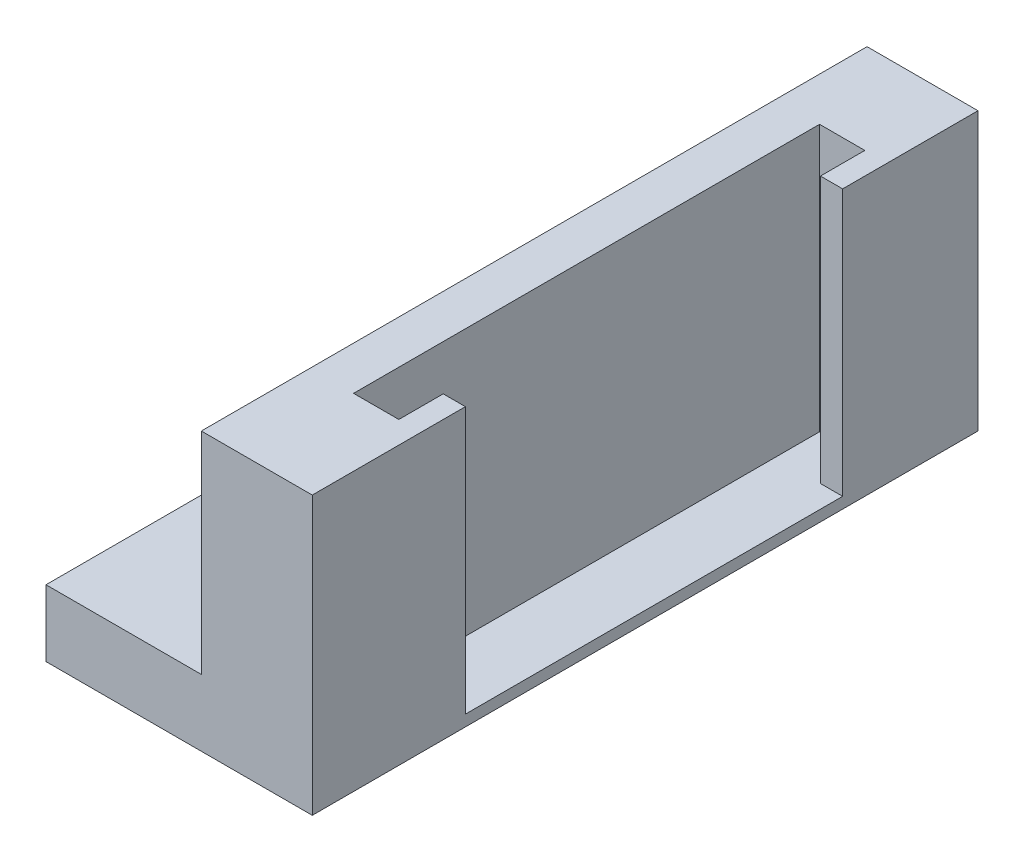
from build123d import *

# Parameters (mm, degrees)
SALIENTE_EXTRUIR1_DEPTH = 30
CORTAR_EXTRUIR1_DEPTH   = 12
CORTAR_EXTRUIR2_REACH   = 35.679
CROQUIS3_R              = 1.65


with BuildPart() as part:
    # Croquis1 → Saliente-Extruir1 (new body)
    with BuildSketch(Plane.XY):
        Polygon((12, 0), (12, 12.5), (7, 12.5), (7, 3), (0, 3), (0, 0), align=None)
    extrude(amount=SALIENTE_EXTRUIR1_DEPTH)

    # Croquis2 → Cortar-Extruir1 (cut)
    with BuildSketch(Plane(origin=(0, 12.5, 0), x_dir=(1, 0, 0), z_dir=(0, 1, 0))):
        Polygon((12, -23.1), (12, -15), (12, -6.1), (11, -6.1), (11, -4.1), (8.96, -4.1), (8.96, -25.1), (11, -25.1), (11, -23.1), align=None)
    extrude(amount=-CORTAR_EXTRUIR1_DEPTH, mode=Mode.SUBTRACT)

    # Croquis3 → Cortar-Extruir2 (cut, up to next)
    with BuildSketch(Plane(origin=(0, 3, 0), x_dir=(1, 0, 0), z_dir=(0, 1, 0)), mode=Mode.PRIVATE) as cortar_extruir2_sk1:
        with Locations((3.5, -6)):
            Circle(CROQUIS3_R)
    cortar_extruir2_tool1 = extrude(cortar_extruir2_sk1.sketch, amount=-CORTAR_EXTRUIR2_REACH, mode=Mode.PRIVATE) & part.part
    # Croquis3 → Cortar-Extruir2 (cut, up to next)
    with BuildSketch(Plane(origin=(0, 3, 0), x_dir=(1, 0, 0), z_dir=(0, 1, 0)), mode=Mode.PRIVATE) as cortar_extruir2_sk2:
        with Locations((3.5, -24)):
            Circle(CROQUIS3_R)
    cortar_extruir2_tool2 = extrude(cortar_extruir2_sk2.sketch, amount=-CORTAR_EXTRUIR2_REACH, mode=Mode.PRIVATE) & part.part
    add(cortar_extruir2_tool1.solids().sort_by_distance((3.5, 3, 6))[0], mode=Mode.SUBTRACT)
    add(cortar_extruir2_tool2.solids().sort_by_distance((3.5, 3, 24))[0], mode=Mode.SUBTRACT)


solid = part.part
